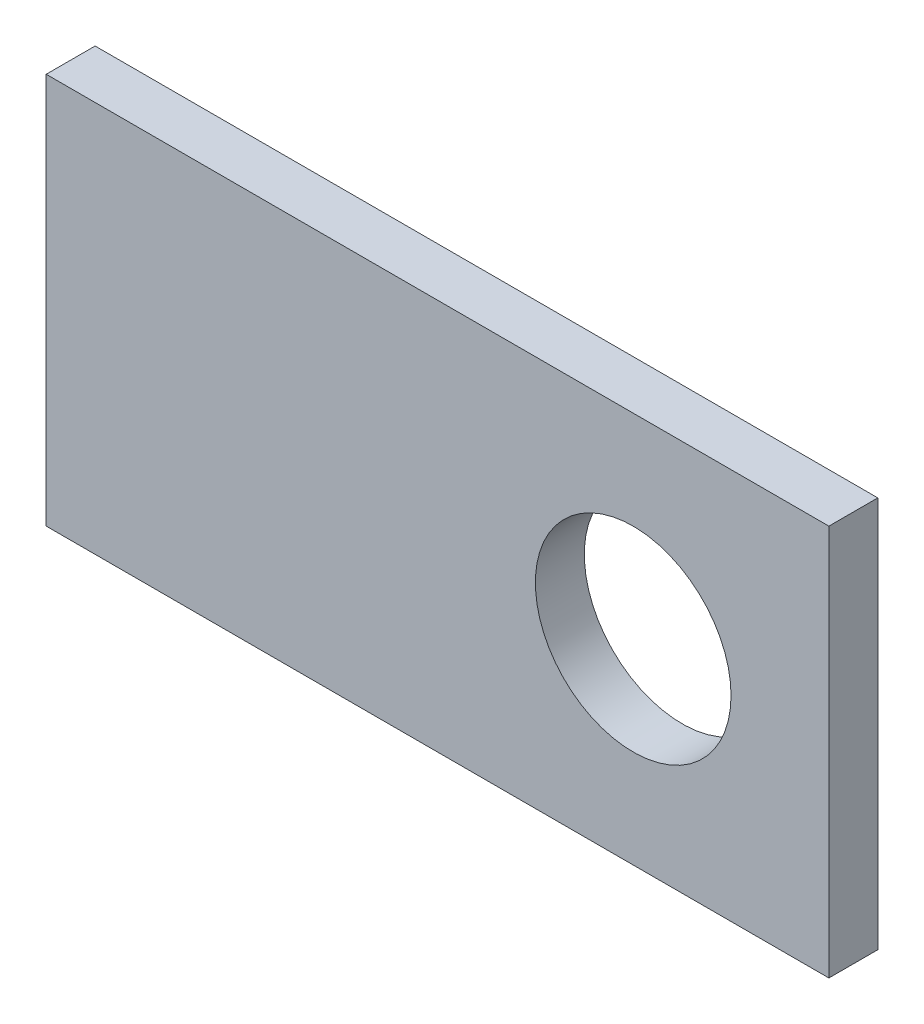
from build123d import *

# Parameters (mm, degrees)
SKETCH1_W           = 50.8
SKETCH1_H           = 25.4
SKETCH1_R           = 6.35
BOSS_EXTRUDE1_DEPTH = 3.175


with BuildPart() as part:
    # Sketch1 → Boss-Extrude1 (new body)
    with BuildSketch(Plane.XY):
        with Locations((25.4, 12.7)):
            Rectangle(SKETCH1_W, SKETCH1_H)
        with Locations((38.1, 12.7)):
            Circle(SKETCH1_R, mode=Mode.SUBTRACT)
    extrude(amount=BOSS_EXTRUDE1_DEPTH)


solid = part.part
